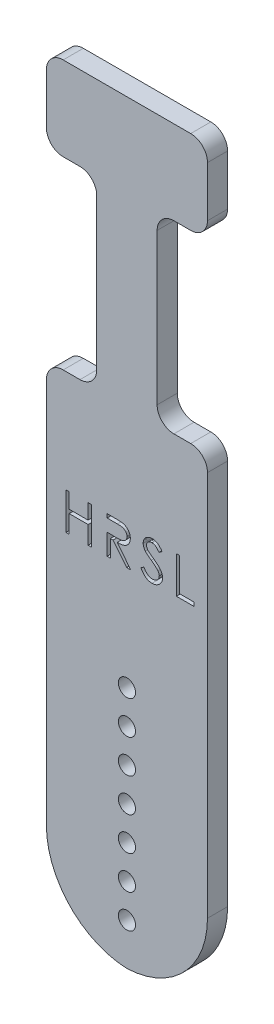
from build123d import *

# Parameters (mm, degrees)
SKETCH1_W               = 48
SKETCH1_H               = 6
BOSS_EXTRUDE1_DEPTH     = 225
FILLET1_R               = 25
SKETCH2_R               = 2.55
CUT_EXTRUDE1_DEPTH      = 227.355914436
LPATTERN1_COUNT         = 7
LPATTERN1_PITCH         = 10
CUT_EXTRUDE2_DEPTH      = 227.296265988
CUT_EXTRUDE2_DEPTH_BACK = 227.296265988
SKETCH12_W              = 15
SKETCH12_H              = 55
FILLET2_R               = 5
CUT_EXTRUDE5_DEPTH      = 227.355914436
CUT_EXTRUDE5_DEPTH_BACK = 227.355914436


with BuildPart() as part:
    # Sketch1 → Boss-Extrude1 (new body)
    with BuildSketch(Plane(origin=(0, 0, 0), x_dir=(1, 0, 0), z_dir=(0, 1, 0))):
        Rectangle(SKETCH1_W, SKETCH1_H)
    extrude(amount=BOSS_EXTRUDE1_DEPTH)

    # Fillet1
    # the kernel refuses this fillet: 25 mm, written as the material it takes off along each edge
    with BuildSketch(Plane(origin=(-24, 0, 65.5), x_dir=(0, 1, 0), z_dir=(0, 0, -1)), Plane(origin=(24, 0, -65.5), x_dir=(0, 1, 0), z_dir=(0, 0, 1))) as fillet1_piece_1:
        with BuildLine():
            CenterArc((FILLET1_R, FILLET1_R), FILLET1_R, 180, 90)
            Line((0, FILLET1_R), (0, 0))
            Line((0, 0), (FILLET1_R, 0))
        make_face()
    extrude(amount=131, mode=Mode.SUBTRACT)

    # Sketch2 → Cut-Extrude1 (cut, through all)
    with BuildSketch(Plane.XY.offset(3)):
        with Locations((0, 12.5)):
            Circle(SKETCH2_R)
    cut_extrude1 = extrude(amount=-CUT_EXTRUDE1_DEPTH, mode=Mode.SUBTRACT)

    # LPattern1: Cut-Extrude1 ×7
    with Locations(*[(0, i * LPATTERN1_PITCH, 0) for i in range(1, LPATTERN1_COUNT)]):
        add(cut_extrude1, mode=Mode.SUBTRACT)

    # Sketch12 → Cut-Extrude2 (cut, two sides: drawn at the far end of the back side and taken through both)
    with BuildSketch(Plane.XY.offset(-CUT_EXTRUDE2_DEPTH_BACK)):
        with Locations((-16.5, 172.5)):
            Rectangle(SKETCH12_W, SKETCH12_H)
        with Locations((16.5, 172.5)):
            Rectangle(SKETCH12_W, SKETCH12_H)
    extrude(amount=CUT_EXTRUDE2_DEPTH + CUT_EXTRUDE2_DEPTH_BACK, mode=Mode.SUBTRACT)

    # Fillet2
    fillet2_edges = [part.edges().sort_by_distance(p)[0] for p in [
        (-24, 225, 0),
        (24, 225, 0),
        (-24, 145, 0),
        (-24, 200, 0),
        (-9, 200, 0),
        (-9, 145, 0),
        (24, 145, 0),
        (9, 145, 0),
        (9, 200, 0),
        (24, 200, 0),
    ]]
    fillet(fillet2_edges, radius=FILLET2_R)

    # Sketch19 → Cut-Extrude5 (cut, two sides: drawn at the far end of the back side and taken through both)
    with BuildSketch(Plane(origin=(0, 0, -3), x_dir=(-1, 0, 0), z_dir=(0, 0, -1)).offset(-CUT_EXTRUDE5_DEPTH_BACK)):
        Polygon((18.206243178, 114.45987953), (17.219063691, 114.45987953), (17.219063691, 109.947059017), (11.57803805, 109.947059017), (11.57803805, 114.45987953), (10.590858562, 114.45987953), (10.590858562, 103.45987953), (11.57803805, 103.45987953), (11.57803805, 108.818853889), (17.219063691, 108.818853889), (17.219063691, 103.45987953), (18.206243178, 103.45987953), align=None)
        with BuildLine():
            Line((5.90880728, 114.45987953), (3.707485165, 114.45987953))
            add(Edge.make_bspline(
                [(3.707485165, 114.45987953), (3.425474932, 114.458273984), (3.021217857, 114.459169071), (2.507261258, 114.43821279), (2.177194127, 114.425317131), (1.884263637, 114.40168965), (1.566335347, 114.374142045), (1.347601683, 114.339642026), (1.215297665, 114.310039787)],
                knots=[0, 0, 0, 0, 0.338434414, 0.484822051, 0.617157578, 0.734698361, 0.837385184, 1, 1, 1, 1], degree=3))
            add(Edge.make_bspline(
                [(1.215297665, 114.310039787), (1.055073202, 114.274837174), (0.822095249, 114.201427963), (0.527850647, 114.07135554), (0.321063296, 113.958407954), (0.127041664, 113.827722765), (-0.056245841, 113.681685892), (-0.229622616, 113.521061676), (-0.386079356, 113.341809742), (-0.533601739, 113.153752035), (-0.658024345, 112.950397365), (-0.765274536, 112.737746978), (-0.850684452, 112.513637435), (-0.919379182, 112.280245281), (-0.985352976, 111.948828956), (-1.001900601, 111.692049895), (-1.00144913, 111.518172799)],
                knots=[0, 0, 0, 0, 0.127063766, 0.188744538, 0.249132103, 0.309452533, 0.369826676, 0.430650142, 0.492351932, 0.554072106, 0.615689784, 0.676797703, 0.738439048, 0.80131691, 0.865184512, 1, 1, 1, 1], degree=3))
            add(Edge.make_bspline(
                [(-1.00144913, 111.518172799), (-1.002451869, 111.232733732), (-0.953842716, 110.808994586), (-0.766095507, 110.283390969), (-0.57669979, 109.924604681), (-0.335216257, 109.601168419), (-0.045066276, 109.317084879), (0.293994014, 109.079359248), (0.609628044, 108.91450757), (0.888444236, 108.80892998), (1.117977483, 108.73464384), (1.368359385, 108.677250918), (1.637191155, 108.625825835), (1.925590602, 108.587037043), (2.347740797, 108.547803991), (2.674618984, 108.537628719), (2.898791255, 108.536802607)],
                knots=[0, 0, 0, 0, 0.153720644, 0.22671353, 0.299191166, 0.371189997, 0.443006414, 0.516689173, 0.593217217, 0.633872918, 0.676989142, 0.722899506, 0.771958611, 0.824211323, 0.879378651, 1, 1, 1, 1], degree=3))
            Line((2.898791255, 108.536802607), (-1.142474771, 103.45987953))
            Line((-1.142474771, 103.45987953), (0.078278434, 103.45987953))
            Line((0.078278434, 103.45987953), (4.11954446, 108.536802607))
            Line((4.11954446, 108.536802607), (4.921627793, 108.536802607))
            Line((4.921627793, 108.536802607), (4.921627793, 103.45987953))
            Line((4.921627793, 103.45987953), (5.90880728, 103.45987953))
            Line((5.90880728, 103.45987953), (5.90880728, 109.665007735))
            Line((5.90880728, 109.665007735), (4.921627793, 109.665007735))
            Line((4.921627793, 109.665007735), (2.907605357, 109.649583056))
            add(Edge.make_bspline(
                [(2.907605357, 109.649583056), (2.725294066, 109.646655468), (2.461481201, 109.656327194), (2.122097923, 109.676328533), (1.895683396, 109.698123771), (1.688275192, 109.726282178), (1.499975844, 109.761489046), (1.330478292, 109.802510398), (1.13279704, 109.86600106), (0.912054528, 109.966591474), (0.672152235, 110.112940166), (0.467871454, 110.297014534), (0.295226926, 110.507502583), (0.156703022, 110.738930625), (0.024949772, 111.073147766), (-0.014946305, 111.340681714), (-0.014269643, 111.520376325)],
                knots=[0, 0, 0, 0, 0.138913286, 0.20118457, 0.259124428, 0.312255041, 0.36068151, 0.405086143, 0.445101659, 0.51877778, 0.589461579, 0.658462242, 0.727283218, 0.796322487, 0.863174893, 1, 1, 1, 1], degree=3))
            add(Edge.make_bspline(
                [(-0.014269643, 111.520376325), (-0.013689164, 111.695225552), (0.022691014, 111.959123656), (0.16160233, 112.282984511), (0.300753335, 112.509777623), (0.470504972, 112.715655385), (0.669493313, 112.891802902), (0.892341038, 113.037158538), (1.10062124, 113.130043712), (1.286786012, 113.186991776), (1.448422064, 113.227067057), (1.631058131, 113.259263089), (1.83558106, 113.285063638), (2.06111735, 113.30721986), (2.404876584, 113.328043206), (2.673254492, 113.332299465), (2.859127793, 113.331674402)],
                knots=[0, 0, 0, 0, 0.136364825, 0.204019354, 0.273063739, 0.34291332, 0.410965444, 0.479168767, 0.549308007, 0.587651576, 0.630646669, 0.678878786, 0.731934299, 0.791111423, 0.85528319, 1, 1, 1, 1], degree=3))
            Line((2.859127793, 113.331674402), (4.921627793, 113.331674402))
            Line((4.921627793, 113.331674402), (5.90880728, 113.331674402))
            Line((5.90880728, 113.331674402), (5.90880728, 114.45987953))
        make_face()
        with BuildLine():
            Line((-4.132218361, 105.581874722), (-5.062106181, 106.13936671))
            add(Edge.make_bspline(
                [(-5.062106181, 106.13936671), (-5.22313139, 105.859826792), (-5.477432954, 105.467809631), (-5.877190106, 105.023879794), (-6.175655584, 104.763295768), (-6.484510528, 104.558510381), (-6.908779611, 104.365409556), (-7.250890146, 104.305437877), (-7.477170284, 104.306033376)],
                knots=[0, 0, 0, 0, 0.3046461, 0.438546905, 0.562322299, 0.677432543, 0.786897393, 1, 1, 1, 1], degree=3))
            add(Edge.make_bspline(
                [(-7.477170284, 104.306033376), (-7.668473687, 104.304308059), (-7.953522474, 104.337919589), (-8.319666989, 104.44393835), (-8.579296425, 104.556372085), (-8.821595763, 104.692616895), (-9.034076237, 104.857124064), (-9.217756361, 105.041316483), (-9.36804132, 105.24680769), (-9.483220828, 105.467791906), (-9.601597286, 105.769683506), (-9.629312148, 106.011722954), (-9.632218361, 106.170216069)],
                knots=[0, 0, 0, 0, 0.180930311, 0.27008822, 0.360156133, 0.448342532, 0.532665842, 0.613833704, 0.693981527, 0.772715977, 0.849335172, 1, 1, 1, 1], degree=3))
            add(Edge.make_bspline(
                [(-9.632218361, 106.170216069), (-9.633253516, 106.356596227), (-9.558187218, 106.745455964), (-9.357695832, 107.085997389), (-9.237787271, 107.249943633)],
                knots=[0, 0, 0, 0, 0.477158319, 1, 1, 1, 1], degree=3))
            add(Edge.make_bspline(
                [(-9.237787271, 107.249943633), (-9.136404048, 107.383673044), (-8.964892185, 107.586464407), (-8.698763604, 107.845155255), (-8.466555582, 108.062242182), (-8.202120433, 108.28313263), (-7.80342222, 108.608560823), (-7.478608583, 108.842542299), (-7.254614194, 109.003950043)],
                knots=[0, 0, 0, 0, 0.189529918, 0.299197872, 0.418925887, 0.548376285, 0.68813637, 1, 1, 1, 1], degree=3))
            add(Edge.make_bspline(
                [(-7.254614194, 109.003950043), (-7.03202411, 109.159722284), (-6.720486617, 109.390865909), (-6.331477465, 109.691769902), (-6.088687251, 109.887540262), (-5.88007004, 110.065396367), (-5.66323325, 110.25946901), (-5.528042373, 110.406345721), (-5.45213022, 110.500143953)],
                knots=[0, 0, 0, 0, 0.347081672, 0.495567816, 0.628357302, 0.74551967, 0.845830751, 1, 1, 1, 1], degree=3))
            add(Edge.make_bspline(
                [(-5.45213022, 110.500143953), (-5.354866056, 110.626068948), (-5.219271012, 110.819388314), (-5.074368042, 111.094994833), (-4.990203934, 111.303954609), (-4.919465551, 111.515271686), (-4.855430148, 111.80427294), (-4.836507423, 112.02642724), (-4.837346566, 112.17482344)],
                knots=[0, 0, 0, 0, 0.262558979, 0.388264447, 0.512667355, 0.63372227, 0.75539386, 1, 1, 1, 1], degree=3))
            add(Edge.make_bspline(
                [(-4.837346566, 112.17482344), (-4.836783151, 112.405002575), (-4.880210093, 112.747421857), (-5.026689153, 113.179015151), (-5.17829663, 113.481765912), (-5.374009986, 113.758230354), (-5.600427737, 114.011589023), (-5.870123564, 114.224567941), (-6.166034177, 114.410694287), (-6.489913219, 114.55623349), (-6.945848563, 114.704417877), (-7.307549059, 114.738825045), (-7.547683104, 114.741930812)],
                knots=[0, 0, 0, 0, 0.165779888, 0.246280008, 0.327460928, 0.408796954, 0.489715241, 0.571376032, 0.655523321, 0.741019483, 0.826546761, 1, 1, 1, 1], degree=3))
            add(Edge.make_bspline(
                [(-7.547683104, 114.741930812), (-7.805138568, 114.742345539), (-8.191737299, 114.695001335), (-8.679354167, 114.523186348), (-8.973026739, 114.378202655), (-9.20287331, 114.233192652), (-9.378159325, 114.101136328), (-9.555783651, 113.949097161), (-9.737191494, 113.776688797), (-9.919256753, 113.582288829), (-10.174245847, 113.287104098), (-10.358595336, 113.048680263), (-10.478372207, 112.879951646)],
                knots=[0, 0, 0, 0, 0.213251813, 0.318830447, 0.426793531, 0.483645951, 0.543603822, 0.60830765, 0.67712676, 0.750685636, 0.828713418, 1, 1, 1, 1], degree=3))
            Line((-10.478372207, 112.879951646), (-9.585944322, 112.203469274))
            add(Edge.make_bspline(
                [(-9.585944322, 112.203469274), (-9.48368231, 112.33837934), (-9.328485533, 112.527524916), (-9.122218178, 112.76481249), (-8.975940584, 112.913379242), (-8.839555076, 113.047581124), (-8.707188482, 113.162485429), (-8.580737522, 113.259204717), (-8.421340928, 113.362443126), (-8.221089893, 113.464653771), (-7.883843507, 113.581402401), (-7.616180877, 113.612643839), (-7.437506822, 113.613725684)],
                knots=[0, 0, 0, 0, 0.189629101, 0.274184089, 0.352183161, 0.423198873, 0.488550946, 0.548473346, 0.601440164, 0.701198082, 0.799591802, 1, 1, 1, 1], degree=3))
            add(Edge.make_bspline(
                [(-7.437506822, 113.613725684), (-7.218855245, 113.616862203), (-6.897619023, 113.570099991), (-6.513623188, 113.395932729), (-6.272974108, 113.219127746), (-6.072883002, 113.009400027), (-5.877882558, 112.686390408), (-5.824850533, 112.406273904), (-5.824526053, 112.221097479)],
                knots=[0, 0, 0, 0, 0.275902964, 0.402370856, 0.528413645, 0.650356379, 0.765895086, 1, 1, 1, 1], degree=3))
            add(Edge.make_bspline(
                [(-5.824526053, 112.221097479), (-5.8207579, 112.102688746), (-5.847625708, 111.92694838), (-5.907147778, 111.696098602), (-5.977224681, 111.523470023), (-6.074221748, 111.349082049), (-6.25415343, 111.095514611), (-6.425713751, 110.919103999), (-6.549485989, 110.79982344)],
                knots=[0, 0, 0, 0, 0.214745861, 0.32293856, 0.434116163, 0.553412311, 0.686072985, 1, 1, 1, 1], degree=3))
            add(Edge.make_bspline(
                [(-6.549485989, 110.79982344), (-6.606019754, 110.748013869), (-6.709403187, 110.662909615), (-6.873484331, 110.540646094), (-7.041470822, 110.413043081), (-7.242530302, 110.265096301), (-7.575711824, 110.028015695), (-7.839825501, 109.837056155), (-8.028051694, 109.704671197)],
                knots=[0, 0, 0, 0, 0.124951974, 0.218093899, 0.333502411, 0.468789179, 0.624937586, 1, 1, 1, 1], degree=3))
            add(Edge.make_bspline(
                [(-8.028051694, 109.704671197), (-8.259520029, 109.536986827), (-8.593849433, 109.291127379), (-9.005764692, 108.949660468), (-9.274368452, 108.709625198), (-9.51597942, 108.478534813), (-9.727930212, 108.253622556), (-9.912359639, 108.03649601), (-10.110971003, 107.758126568), (-10.313544157, 107.416233223), (-10.543038713, 106.868453471), (-10.619179323, 106.437853503), (-10.619397848, 106.154791389)],
                knots=[0, 0, 0, 0, 0.187773439, 0.272396139, 0.351320997, 0.424334774, 0.491908784, 0.55423322, 0.611267658, 0.716347845, 0.814540086, 1, 1, 1, 1], degree=3))
            add(Edge.make_bspline(
                [(-10.619397848, 106.154791389), (-10.622449443, 105.959260774), (-10.590527921, 105.669835578), (-10.497217896, 105.29550084), (-10.393531193, 105.028633086), (-10.266761997, 104.768579276), (-10.105964586, 104.522154119), (-9.919566006, 104.283905564), (-9.705746443, 104.060185845), (-9.471773393, 103.854812654), (-9.224481788, 103.672119285), (-8.963466824, 103.519797667), (-8.690143397, 103.395467717), (-8.404453064, 103.298351214), (-8.001889166, 103.20265391), (-7.688231617, 103.177013861), (-7.477170284, 103.177828248)],
                knots=[0, 0, 0, 0, 0.121774528, 0.18091956, 0.240256115, 0.300114444, 0.361145948, 0.423500582, 0.488669361, 0.553954105, 0.617581261, 0.680238427, 0.742187389, 0.804663212, 0.868258989, 1, 1, 1, 1], degree=3))
            add(Edge.make_bspline(
                [(-7.477170284, 103.177828248), (-7.311912196, 103.176839477), (-7.06672561, 103.196808616), (-6.745445663, 103.250857576), (-6.514083693, 103.314177885), (-6.287681143, 103.391127819), (-6.067218203, 103.485842272), (-5.85258924, 103.599355116), (-5.642591073, 103.729139012), (-5.437758092, 103.880177833), (-5.240010655, 104.056094221), (-5.042863945, 104.252038371), (-4.852123435, 104.473324182), (-4.663985657, 104.71640494), (-4.414472, 105.082408334), (-4.242760053, 105.376960195), (-4.132218361, 105.581874722)],
                knots=[0, 0, 0, 0, 0.11369606, 0.169177916, 0.224159217, 0.278719878, 0.333794217, 0.389241459, 0.445822073, 0.503704281, 0.564293892, 0.627975416, 0.69503826, 0.765372726, 0.839611443, 1, 1, 1, 1], degree=3))
        make_face()
        Polygon((-14.737346566, 114.45987953), (-15.724526053, 114.45987953), (-15.724526053, 104.588084658), (-19.955295284, 104.588084658), (-19.955295284, 103.45987953), (-14.737346566, 103.45987953), align=None)
    extrude(amount=CUT_EXTRUDE5_DEPTH + CUT_EXTRUDE5_DEPTH_BACK, mode=Mode.SUBTRACT)


solid = part.part
